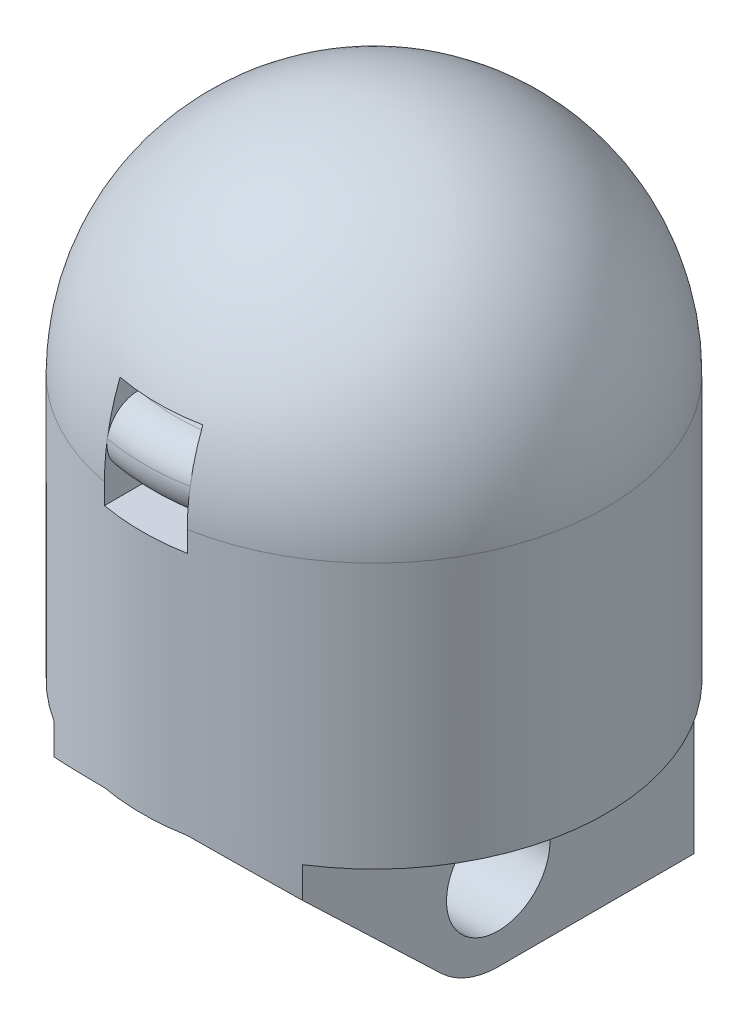
from build123d import *

# Parameters (mm, degrees)
CUT_EXTRUDE1_DEPTH      = 11.43
SKETCH3_R               = 3.175
CUT_EXTRUDE2_DEPTH      = 50.355147776
CUT_EXTRUDE3_DEPTH      = 47.487551581
CUT_EXTRUDE3_DEPTH_BACK = 47.487551581
SKETCH4_W               = 5.08
SKETCH4_H               = 1.27
FILLET1_R               = 1.905


with BuildPart() as part:
    # Sketch1 → Revolve1 (revolve)
    with BuildSketch(Plane.XY):
        with BuildLine():
            Line((0, 0), (0, 5.602635041))
            Line((0, 5.602635041), (-2.54, 5.602635041))
            Line((-2.54, 5.602635041), (-2.54, 22.86))
            ThreePointArc((-2.54, 22.86), (-5.294384008, 28.994194932), (0, 33.139611281))
            Line((0, 33.139611281), (0, 41.91))
            ThreePointArc((0, 41.91), (-10.057886856, 37.743886856), (-14.224, 27.686))
            Line((-14.224, 27.686), (-14.224, 0))
            Line((-14.224, 0), (0, 0))
        make_face()
    revolve(axis=Axis((0, 0, 0), (0, 1, 0)))

    # Sketch2 → Cut-Extrude1 (cut)
    with BuildSketch(Plane.XZ):
        with BuildLine():
            Line((-2.54, 13.995376951), (-2.54, -13.995376951))
            ThreePointArc((-2.54, -13.995376951), (0, -14.224), (2.54, -13.995376951))
            Line((2.54, -13.995376951), (2.54, 13.995376951))
            ThreePointArc((2.54, 13.995376951), (0, 14.224), (-2.54, 13.995376951))
        make_face()
        with BuildLine():
            Line((-7.62, 12.010735864), (-7.62, -12.010735864))
            ThreePointArc((-7.62, -12.010735864), (-14.224, 0), (-7.62, 12.010735864))
        make_face()
        with BuildLine():
            Line((7.62, 12.010735864), (7.62, -12.010735864))
            ThreePointArc((7.62, -12.010735864), (14.224, 0), (7.62, 12.010735864))
        make_face()
    extrude(amount=-CUT_EXTRUDE1_DEPTH, mode=Mode.SUBTRACT)

    # Sketch3 → Cut-Extrude2 (cut, through all)
    with BuildSketch(Plane.ZY.offset(7.62)):
        with Locations((0, 5.08)):
            Circle(SKETCH3_R)
        with BuildLine():
            Line((3.510108408, 1.40773381), (13.995376951, 11.43))
            Line((13.995376951, 11.43), (13.995376951, 0))
            Line((13.995376951, 0), (0, 0))
            ThreePointArc((0, 0), (1.890937302, 0.365049722), (3.510108408, 1.40773381))
        make_face()
    extrude(amount=-CUT_EXTRUDE2_DEPTH, mode=Mode.SUBTRACT)

    # Sketch4 → Cut-Extrude3 (cut, two sides: drawn at the far end of the back side and taken through both)
    with BuildSketch(Plane.XY.offset(-CUT_EXTRUDE3_DEPTH_BACK)):
        with Locations((0, 27.051)):
            Rectangle(SKETCH4_W, SKETCH4_H)
        with Locations((0, 32.131)):
            Rectangle(SKETCH4_W, SKETCH4_H)
    extrude(amount=CUT_EXTRUDE3_DEPTH + CUT_EXTRUDE3_DEPTH_BACK, mode=Mode.SUBTRACT)

    # Fillet1
    # the kernel refuses this fillet: 1.905 mm, written as the material it takes off along each edge
    with BuildSketch(Plane(origin=(0, 27.686, 0), x_dir=(-0.5373639456593198, 0, 0.8433504549743527), z_dir=(-0.8433504549743527, 0, -0.5373639456593198))) as fillet1_piece_1_section:
        with BuildLine():
            CenterArc((12.170814928, 1.905), FILLET1_R, 270, 98.895870208)
            Line((12.170814928, 0), (14.224, 0))
            ThreePointArc((14.224, 0), (14.181160416, 1.10311616), (14.05289971, 2.199587629))
        make_face()
    fillet1_piece_1 = revolve(axis=Axis((0, 27.686, 0), (0, 1, 0)), revolution_arc=65.00874172, mode=Mode.PRIVATE)
    fillet1_piece_1 = split(fillet1_piece_1, bisect_by=Plane(origin=(2.54, 28.192059722, 13.665836287), z_dir=(-1, 0, 0)), keep=Keep.TOP, mode=Mode.PRIVATE)
    fillet1_piece_1 = split(fillet1_piece_1, bisect_by=Plane(origin=(-2.54, 28.192059722, 13.665836287), z_dir=(1, 0, 0)), keep=Keep.TOP, mode=Mode.PRIVATE)
    add(fillet1_piece_1, mode=Mode.SUBTRACT)
    with BuildSketch(Plane(origin=(0, 31.496, 0), x_dir=(0.46799048823775274, 0, 0.883733502204703), z_dir=(0.883733502204703, 0, -0.46799048823775274))) as fillet1_piece_2_section:
        with BuildLine():
            CenterArc((12.170814928, 1.905), FILLET1_R, 270, 81.104129792)
            Line((12.170814928, 0), (13.704235696, 0))
            ThreePointArc((13.704235696, 0), (13.90190629, 0.80015324), (14.05289971, 1.610412371))
        make_face()
    fillet1_piece_2 = revolve(axis=Axis((0, 31.496, 0), (0, -1, 0)), revolution_arc=55.807867303, mode=Mode.PRIVATE)
    fillet1_piece_2 = split(fillet1_piece_2, bisect_by=Plane(origin=(-2.54, 31.138166145, 13.379180575), z_dir=(1, 0, 0)), keep=Keep.TOP, mode=Mode.PRIVATE)
    fillet1_piece_2 = split(fillet1_piece_2, bisect_by=Plane(origin=(2.54, 31.138166145, 13.379180575), z_dir=(-1, 0, 0)), keep=Keep.TOP, mode=Mode.PRIVATE)
    add(fillet1_piece_2, mode=Mode.SUBTRACT)
    with BuildSketch(Plane(origin=(0, 31.496, 0), x_dir=(-0.4679904882377507, 0, -0.883733502204704), z_dir=(-0.883733502204704, 0, 0.4679904882377507))) as fillet1_piece_3_section:
        with BuildLine():
            CenterArc((12.170814928, 1.905), FILLET1_R, 270, 81.104129792)
            Line((12.170814928, 0), (13.704235696, 0))
            ThreePointArc((13.704235696, 0), (13.90190629, 0.80015324), (14.05289971, 1.610412371))
        make_face()
    fillet1_piece_3 = revolve(axis=Axis((0, 31.496, 0), (0, -1, 0)), revolution_arc=55.807867303, mode=Mode.PRIVATE)
    fillet1_piece_3 = split(fillet1_piece_3, bisect_by=Plane(origin=(-2.54, 31.138166145, -13.379180575), z_dir=(1, 0, 0)), keep=Keep.TOP, mode=Mode.PRIVATE)
    fillet1_piece_3 = split(fillet1_piece_3, bisect_by=Plane(origin=(2.54, 31.138166145, -13.379180575), z_dir=(-1, 0, 0)), keep=Keep.TOP, mode=Mode.PRIVATE)
    add(fillet1_piece_3, mode=Mode.SUBTRACT)
    with BuildSketch(Plane(origin=(0, 27.686, 0), x_dir=(0.5373639456593708, 0, -0.84335045497432), z_dir=(0.84335045497432, 0, 0.5373639456593708))) as fillet1_piece_4_section:
        with BuildLine():
            CenterArc((12.170814928, 1.905), FILLET1_R, 270, 98.895870208)
            Line((12.170814928, 0), (14.224, 0))
            ThreePointArc((14.224, 0), (14.181160416, 1.10311616), (14.05289971, 2.199587629))
        make_face()
    fillet1_piece_4 = revolve(axis=Axis((0, 27.686, 0), (0, 1, 0)), revolution_arc=65.00874172, mode=Mode.PRIVATE)
    fillet1_piece_4 = split(fillet1_piece_4, bisect_by=Plane(origin=(-2.54, 28.192059722, -13.665836287), z_dir=(1, 0, 0)), keep=Keep.TOP, mode=Mode.PRIVATE)
    fillet1_piece_4 = split(fillet1_piece_4, bisect_by=Plane(origin=(2.54, 28.192059722, -13.665836287), z_dir=(-1, 0, 0)), keep=Keep.TOP, mode=Mode.PRIVATE)
    add(fillet1_piece_4, mode=Mode.SUBTRACT)


solid = part.part
